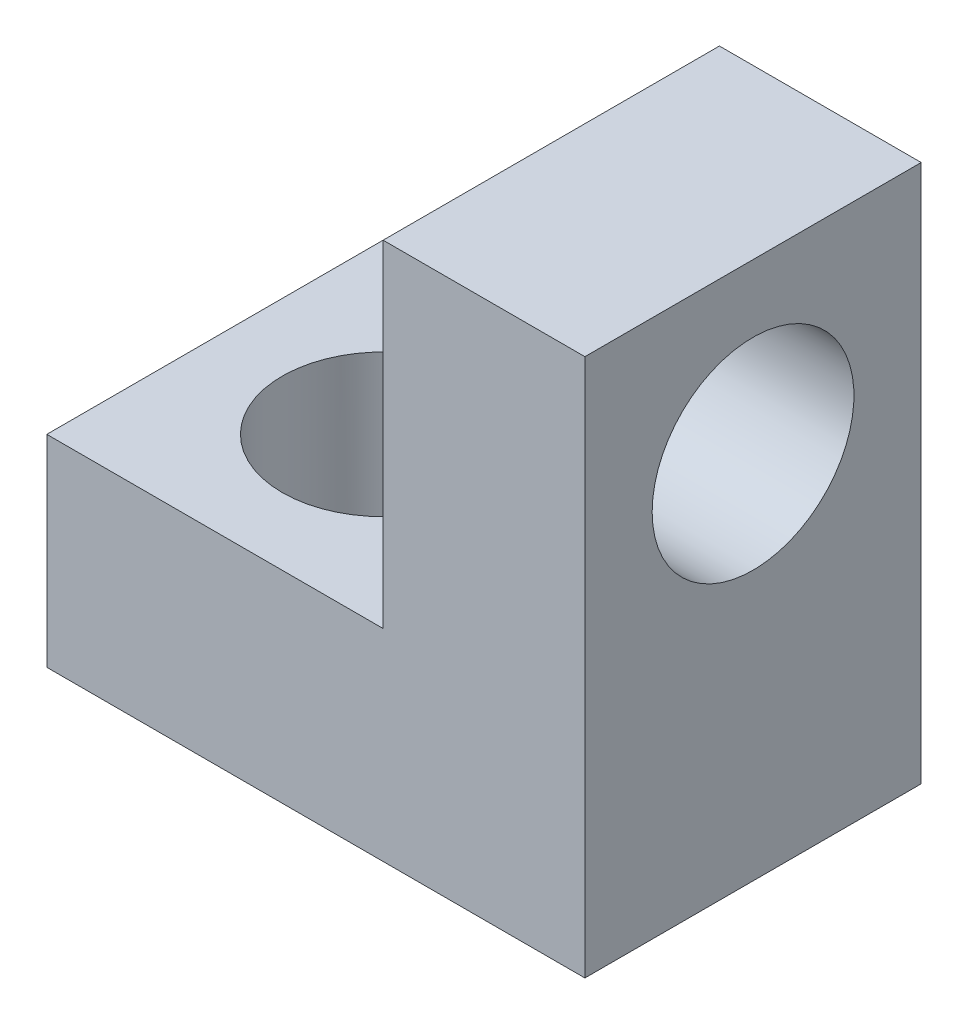
from build123d import *

# Parameters (mm, degrees)
SKETCH1_W           = 8
SKETCH1_H           = 5
BOSS_EXTRUDE1_DEPTH = 3
SKETCH2_W           = 3
SKETCH2_H           = 5
BOSS_EXTRUDE2_DEPTH = 5
SKETCH3_R           = 1.5
CUT_EXTRUDE1_DEPTH  = 5
SKETCH4_R           = 1.5
CUT_EXTRUDE2_DEPTH  = 5


with BuildPart() as part:
    # Sketch1 → Boss-Extrude1 (new body)
    with BuildSketch(Plane(origin=(0, 0, 0), x_dir=(1, 0, 0), z_dir=(0, 1, 0))):
        Rectangle(SKETCH1_W, SKETCH1_H)
    extrude(amount=BOSS_EXTRUDE1_DEPTH)

    # Sketch2 → Boss-Extrude2 (add)
    with BuildSketch(Plane(origin=(0, 3, 0), x_dir=(1, 0, 0), z_dir=(0, 1, 0))):
        with Locations((2.5, 0)):
            Rectangle(SKETCH2_W, SKETCH2_H)
    extrude(amount=BOSS_EXTRUDE2_DEPTH)

    # Sketch3 → Cut-Extrude1 (cut)
    with BuildSketch(Plane(origin=(0, 3, 0), x_dir=(1, 0, 0), z_dir=(0, 1, 0))):
        with Locations((-1.5, 0)):
            Circle(SKETCH3_R)
    extrude(amount=-CUT_EXTRUDE1_DEPTH, mode=Mode.SUBTRACT)

    # Sketch4 → Cut-Extrude2 (cut)
    with BuildSketch(Plane.ZY.offset(-1)):
        with Locations((0, 5.5)):
            Circle(SKETCH4_R)
    extrude(amount=-CUT_EXTRUDE2_DEPTH, mode=Mode.SUBTRACT)


solid = part.part
